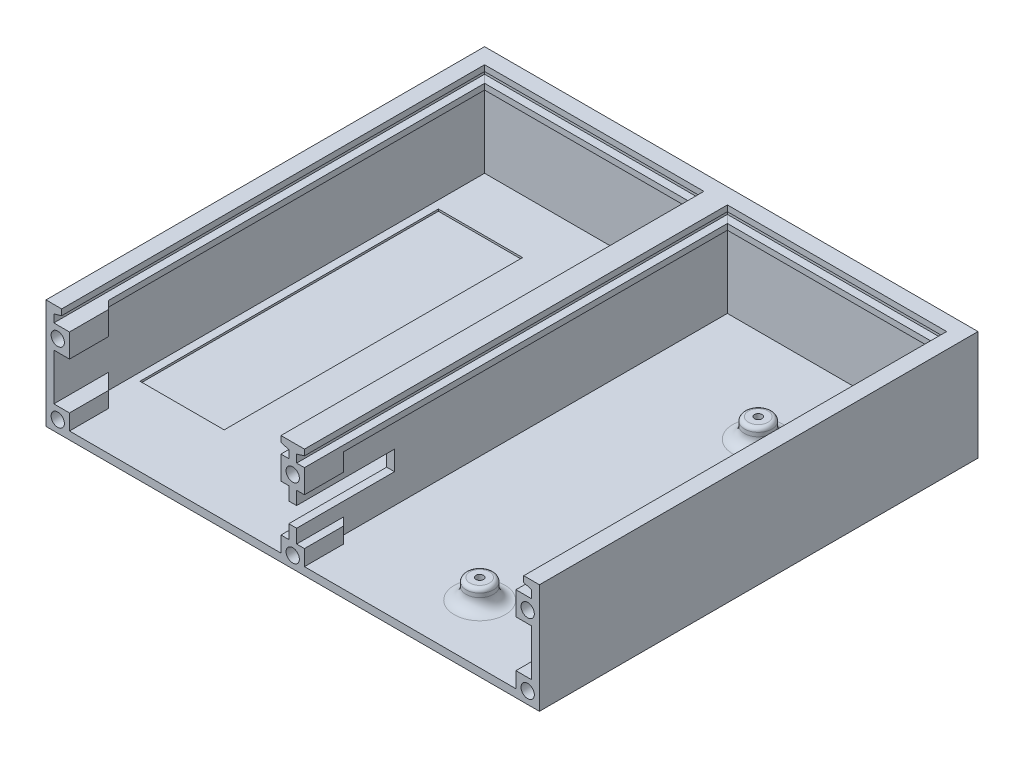
from build123d import *

# Parameters (mm, degrees)
SKIZZE1_W                            = 126
SKIZZE1_H                            = 28
AUFSATZ_LINEAR_AUSTRAGEN1_DEPTH      = 2
AUFSATZ_LINEAR_AUSTRAGEN2_DEPTH      = 110
AUSTRAGUNG1_START                    = 1
AUSTRAGUNG1_OUTLINE_W                = 56
AUSTRAGUNG1_OUTLINE_H                = 1.5
AUSTRAGUNG1_DEPTH                    = 3
AUSTRAGUNG1_2_OUTLINE_W              = 2
AUSTRAGUNG1_2_OUTLINE_H              = 1.5
AUSTRAGUNG1_2_DEPTH                  = 111
AUSTRAGUNG1_3_DEPTH                  = 62
AUSTRAGUNG2_START                    = 1
AUSTRAGUNG2_OUTLINE_W                = 56
AUSTRAGUNG2_OUTLINE_H                = 1.5
AUSTRAGUNG2_DEPTH                    = 3
AUSTRAGUNG2_2_OUTLINE_W              = 2
AUSTRAGUNG2_2_OUTLINE_H              = 1.5
AUSTRAGUNG2_2_DEPTH                  = 111
AUSTRAGUNG2_START_2                  = 63
AUSTRAGUNG2_3_DEPTH                  = 62
SKIZZE8_W                            = 6
SKIZZE8_H                            = 6
SKIZZE8_H_2                          = 4
SKIZZE8_W_2                          = 4
AUFSATZ_LINEAR_AUSTRAGEN4_DEPTH      = 10
F_3_4_3_4_DURCHMESSER_BOHRUNG1_D     = 3.4
F_3_4_3_4_DURCHMESSER_BOHRUNG1_DEPTH = 6
F_3_4_3_4_DURCHMESSER_BOHRUNG1_TIP   = 1.021463052
FASE1_SIZE                           = 4
FASE2_SIZE                           = 2
SKIZZE11_W                           = 21.5
SKIZZE11_H                           = 76.2
SCHNITT_LINEAR_AUSTRAGEN1_DEPTH      = 0.5
SKIZZE12_R                           = 3.5
AUFSATZ_LINEAR_AUSTRAGEN5_DEPTH      = 5
F_1_9_1_9_DURCHMESSER_BOHRUNG1_D     = 1.9
F_1_9_1_9_DURCHMESSER_BOHRUNG1_DEPTH = 5
F_1_9_1_9_DURCHMESSER_BOHRUNG1_TIP   = 0.570817588
VERRUNDUNG1_R                        = 3
VERRUNDUNG2_R                        = 1
SKIZZE17_W                           = 2
SKIZZE17_H                           = 5
SCHNITT_LINEAR_AUSTRAGEN2_DEPTH      = 25


with BuildPart() as part:
    # Skizze1 → Aufsatz-Linear austragen1 (new body)
    with BuildSketch(Plane.XY):
        with Locations((63, 14)):
            Rectangle(SKIZZE1_W, SKIZZE1_H)
    extrude(amount=AUFSATZ_LINEAR_AUSTRAGEN1_DEPTH)

    # Skizze2 → Aufsatz-Linear austragen2 (add)
    with BuildSketch(Plane.XY.offset(2)):
        Polygon((0, 28), (0, 0), (126, 0), (126, 28), (124, 28), (124, 2), (64, 2), (64, 28), (62, 28), (62, 2), (2, 2), (2, 28), align=None)
    extrude(amount=AUFSATZ_LINEAR_AUSTRAGEN2_DEPTH)

    # Austragung1: read off the stored shape, not the designer's step
    # Austragung1 outline → Austragung1 (add)
    with BuildSketch(Plane.XY.offset(AUSTRAGUNG1_START)):
        with Locations((32, 23.15)):
            Rectangle(AUSTRAGUNG1_OUTLINE_W, AUSTRAGUNG1_OUTLINE_H)
    extrude(amount=AUSTRAGUNG1_DEPTH)

    # Austragung1 2 outline → Austragung1 2 (add)
    with BuildSketch(Plane.XY.offset(AUSTRAGUNG1_START)):
        with Locations((61, 23.15)):
            Rectangle(AUSTRAGUNG1_2_OUTLINE_W, AUSTRAGUNG1_2_OUTLINE_H)
        with Locations((3, 23.15)):
            Rectangle(AUSTRAGUNG1_2_OUTLINE_W, AUSTRAGUNG1_2_OUTLINE_H)
        Polygon((60, 26.5), (62, 25.9), (62, 28), (60, 28), align=None)
        Polygon((2, 28), (2, 25.9), (4, 26.5), (4, 28), align=None)
    extrude(amount=AUSTRAGUNG1_2_DEPTH)

    # Austragung1 3 outline → Austragung1 3 (add)
    with BuildSketch(Plane.YZ.offset(AUSTRAGUNG1_START)):
        Polygon((28, 4), (26.5, 4), (25.9, 2), (28, 2), align=None)
    extrude(amount=AUSTRAGUNG1_3_DEPTH)

    # Austragung2: read off the stored shape, not the designer's step
    # Austragung2 outline → Austragung2 (add)
    with BuildSketch(Plane.XY.offset(AUSTRAGUNG2_START)):
        with Locations((94, 23.15)):
            Rectangle(AUSTRAGUNG2_OUTLINE_W, AUSTRAGUNG2_OUTLINE_H)
    extrude(amount=AUSTRAGUNG2_DEPTH)

    # Austragung2 2 outline → Austragung2 2 (add)
    with BuildSketch(Plane.XY.offset(AUSTRAGUNG2_START)):
        with Locations((65, 23.15)):
            Rectangle(AUSTRAGUNG2_2_OUTLINE_W, AUSTRAGUNG2_2_OUTLINE_H)
        with Locations((123, 23.15)):
            Rectangle(AUSTRAGUNG2_2_OUTLINE_W, AUSTRAGUNG2_2_OUTLINE_H)
        Polygon((64, 28), (64, 25.9), (66, 26.5), (66, 28), align=None)
        Polygon((122, 26.5), (124, 25.9), (124, 28), (122, 28), align=None)
    extrude(amount=AUSTRAGUNG2_2_DEPTH)

    # Austragung2 3 outline → Austragung2 3 (add)
    with BuildSketch(Plane.YZ.offset(AUSTRAGUNG2_START_2)):
        Polygon((28, 4), (26.5, 4), (25.9, 2), (28, 2), align=None)
    extrude(amount=AUSTRAGUNG2_3_DEPTH)

    # Skizze8 → Aufsatz-Linear austragen4 (add)
    with BuildSketch(Plane.XY.offset(112)):
        with Locations((63, 20.9)):
            Rectangle(SKIZZE8_W, SKIZZE8_H)
        with Locations((63, 4)):
            Rectangle(SKIZZE8_W, SKIZZE8_H_2)
        with Locations((4, 4)):
            Rectangle(SKIZZE8_W_2, SKIZZE8_H_2)
        with Locations((4, 20.9)):
            Rectangle(SKIZZE8_W_2, SKIZZE8_H)
        with Locations((122, 20.9)):
            Rectangle(SKIZZE8_W_2, SKIZZE8_H)
        with Locations((122, 4)):
            Rectangle(SKIZZE8_W_2, SKIZZE8_H_2)
    extrude(amount=-AUFSATZ_LINEAR_AUSTRAGEN4_DEPTH)

    # Ø3.4 (3.4) Durchmesser Bohrung1
    with Locations(Plane.XY.offset(112)):
        with Locations((3, 20.9), (3, 3), (63, 3), (63, 20.9), (123, 20.9), (123, 3)):
            Hole(F_3_4_3_4_DURCHMESSER_BOHRUNG1_D / 2, depth=F_3_4_3_4_DURCHMESSER_BOHRUNG1_DEPTH)
            with Locations((0, 0, -(F_3_4_3_4_DURCHMESSER_BOHRUNG1_DEPTH + F_3_4_3_4_DURCHMESSER_BOHRUNG1_TIP / 2))):  # 118° drill point
                Cone(0, F_3_4_3_4_DURCHMESSER_BOHRUNG1_D / 2, F_3_4_3_4_DURCHMESSER_BOHRUNG1_TIP, mode=Mode.SUBTRACT)

    # Fase1
    # the kernel refuses this chamfer: 4 mm, written as the material it adds along each edge
    with BuildSketch(Plane(origin=(2, 17.9, 102), x_dir=(0, 0, -1), z_dir=(0, 1, 0))) as fase1_piece_1_section:
        Polygon((FASE1_SIZE, 0), (0, -FASE1_SIZE), (0, 0), align=None)
    fase1_piece_1 = extrude(amount=14.786731952, mode=Mode.PRIVATE)
    fase1_piece_1 = split(fase1_piece_1, bisect_by=Plane(origin=(2, 23.9, 102), z_dir=(0, -1, 0)), keep=Keep.TOP, mode=Mode.PRIVATE)
    add(fase1_piece_1)
    with BuildSketch(Plane(origin=(2, 2, 102), x_dir=(0, 0, -1), z_dir=(0, 1, 0))) as fase1_piece_2:
        Polygon((FASE1_SIZE, 0), (0, -FASE1_SIZE), (0, 0), align=None)
    extrude(amount=4)
    with BuildSketch(Plane(origin=(124, 17.9, 102), x_dir=(0, 0, -1), z_dir=(0, 1, 0))) as fase1_piece_3_section:
        Polygon((FASE1_SIZE, 0), (0, FASE1_SIZE), (0, 0), align=None)
    fase1_piece_3 = extrude(amount=14.786731952, mode=Mode.PRIVATE)
    fase1_piece_3 = split(fase1_piece_3, bisect_by=Plane(origin=(124, 23.9, 102), z_dir=(0, -1, 0)), keep=Keep.TOP, mode=Mode.PRIVATE)
    add(fase1_piece_3)
    with BuildSketch(Plane(origin=(124, 2, 102), x_dir=(0, 0, -1), z_dir=(0, 1, 0))) as fase1_piece_4:
        Polygon((FASE1_SIZE, 0), (0, FASE1_SIZE), (0, 0), align=None)
    extrude(amount=4)
    with BuildSketch(Plane(origin=(16.286731952, 2, 102), x_dir=(0, 0, -1), z_dir=(-1, 0, 0))) as fase1_piece_5_section:
        Polygon((FASE1_SIZE, 0), (0, -FASE1_SIZE), (0, 0), align=None)
    fase1_piece_5 = extrude(amount=14.286731952, mode=Mode.PRIVATE)
    fase1_piece_5 = split(fase1_piece_5, bisect_by=Plane(origin=(11.143365976, 2, 107.143365976), z_dir=(-0.7071067811865476, 0, 0.7071067811865476)), keep=Keep.TOP, mode=Mode.PRIVATE)
    add(fase1_piece_5)

    # Fase2
    fase2_edges = [part.edges().sort_by_distance(p)[0] for p in [
        (62, 4, 102),
        (62, 20.15, 102),
        (64, 4, 102),
    ]]
    chamfer(fase2_edges, length=FASE2_SIZE - 0.0001)  # a hair under: the kernel refuses the full size

    # Skizze11 → Schnitt-Linear austragen1 (cut)
    with BuildSketch(Plane(origin=(0, 2, 0), x_dir=(1, 0, 0), z_dir=(0, 1, 0))):
        with Locations((14.75, -53.9)):
            Rectangle(SKIZZE11_W, SKIZZE11_H)
    extrude(amount=-SCHNITT_LINEAR_AUSTRAGEN1_DEPTH, mode=Mode.SUBTRACT)

    # Skizze12 → Aufsatz-Linear austragen5 (add)
    with BuildSketch(Plane(origin=(0, 2, 0), x_dir=(1, 0, 0), z_dir=(0, 1, 0))):
        with Locations((119, -97)):
            Circle(SKIZZE12_R)
        with Locations((119, -25.88)):
            Circle(SKIZZE12_R)
        with Locations((95.76, -25.88)):
            Circle(SKIZZE12_R)
        with Locations((95.76, -97)):
            Circle(SKIZZE12_R)
    extrude(amount=AUFSATZ_LINEAR_AUSTRAGEN5_DEPTH)

    # Ø1.9 (1.9) Durchmesser Bohrung1
    with Locations(Plane(origin=(0, 7, 0), x_dir=(1, 0, 0), z_dir=(0, 1, 0))):
        with Locations((119, -97), (95.76, -97), (119, -25.88), (95.76, -25.88)):
            Hole(F_1_9_1_9_DURCHMESSER_BOHRUNG1_D / 2, depth=F_1_9_1_9_DURCHMESSER_BOHRUNG1_DEPTH)
            with Locations((0, 0, -(F_1_9_1_9_DURCHMESSER_BOHRUNG1_DEPTH + F_1_9_1_9_DURCHMESSER_BOHRUNG1_TIP / 2))):  # 118° drill point
                Cone(0, F_1_9_1_9_DURCHMESSER_BOHRUNG1_D / 2, F_1_9_1_9_DURCHMESSER_BOHRUNG1_TIP, mode=Mode.SUBTRACT)

    # Verrundung1
    # the kernel refuses this fillet: 3 mm, written as the material it adds along each edge
    with BuildSketch(Plane(origin=(119, 2, 97), x_dir=(1, 0, 0), z_dir=(0, 0, 1))) as verrundung1_piece_1:
        with BuildLine():
            CenterArc((3.5 + VERRUNDUNG1_R, VERRUNDUNG1_R), VERRUNDUNG1_R, 180, 90)
            Line((3.5, VERRUNDUNG1_R), (3.5, 0))
            Line((3.5, 0), (3.5 + VERRUNDUNG1_R, 0))
        make_face()
    revolve(axis=Axis((119, 2, 97), (0, 1, 0)))
    with BuildSketch(Plane(origin=(119, 2, 25.88), x_dir=(1, 0, 0), z_dir=(0, 0, 1))) as verrundung1_piece_2:
        with BuildLine():
            CenterArc((3.5 + VERRUNDUNG1_R, VERRUNDUNG1_R), VERRUNDUNG1_R, 180, 90)
            Line((3.5, VERRUNDUNG1_R), (3.5, 0))
            Line((3.5, 0), (3.5 + VERRUNDUNG1_R, 0))
        make_face()
    revolve(axis=Axis((119, 2, 25.88), (0, 1, 0)))
    with BuildSketch(Plane(origin=(95.76, 2, 25.88), x_dir=(1, 0, 0), z_dir=(0, 0, 1))) as verrundung1_piece_3:
        with BuildLine():
            CenterArc((3.5 + VERRUNDUNG1_R, VERRUNDUNG1_R), VERRUNDUNG1_R, 180, 90)
            Line((3.5, VERRUNDUNG1_R), (3.5, 0))
            Line((3.5, 0), (3.5 + VERRUNDUNG1_R, 0))
        make_face()
    revolve(axis=Axis((95.76, 2, 25.88), (0, 1, 0)))
    with BuildSketch(Plane(origin=(95.76, 2, 97), x_dir=(1, 0, 0), z_dir=(0, 0, 1))) as verrundung1_piece_4:
        with BuildLine():
            CenterArc((3.5 + VERRUNDUNG1_R, VERRUNDUNG1_R), VERRUNDUNG1_R, 180, 90)
            Line((3.5, VERRUNDUNG1_R), (3.5, 0))
            Line((3.5, 0), (3.5 + VERRUNDUNG1_R, 0))
        make_face()
    revolve(axis=Axis((95.76, 2, 97), (0, 1, 0)))

    # Verrundung2
    verrundung2_edges = [part.edges().sort_by_distance(p)[0] for p in [
        (92.26, 7, 97),
        (92.26, 7, 25.88),
        (115.5, 7, 25.88),
        (115.5, 7, 97),
    ]]
    fillet(verrundung2_edges, radius=VERRUNDUNG2_R)

    # Skizze17 → Schnitt-Linear austragen2 (cut)
    with BuildSketch(Plane.XY.offset(112)):
        with Locations((63, 12)):
            Rectangle(SKIZZE17_W, SKIZZE17_H)
    extrude(amount=-SCHNITT_LINEAR_AUSTRAGEN2_DEPTH, mode=Mode.SUBTRACT)


solid = part.part
